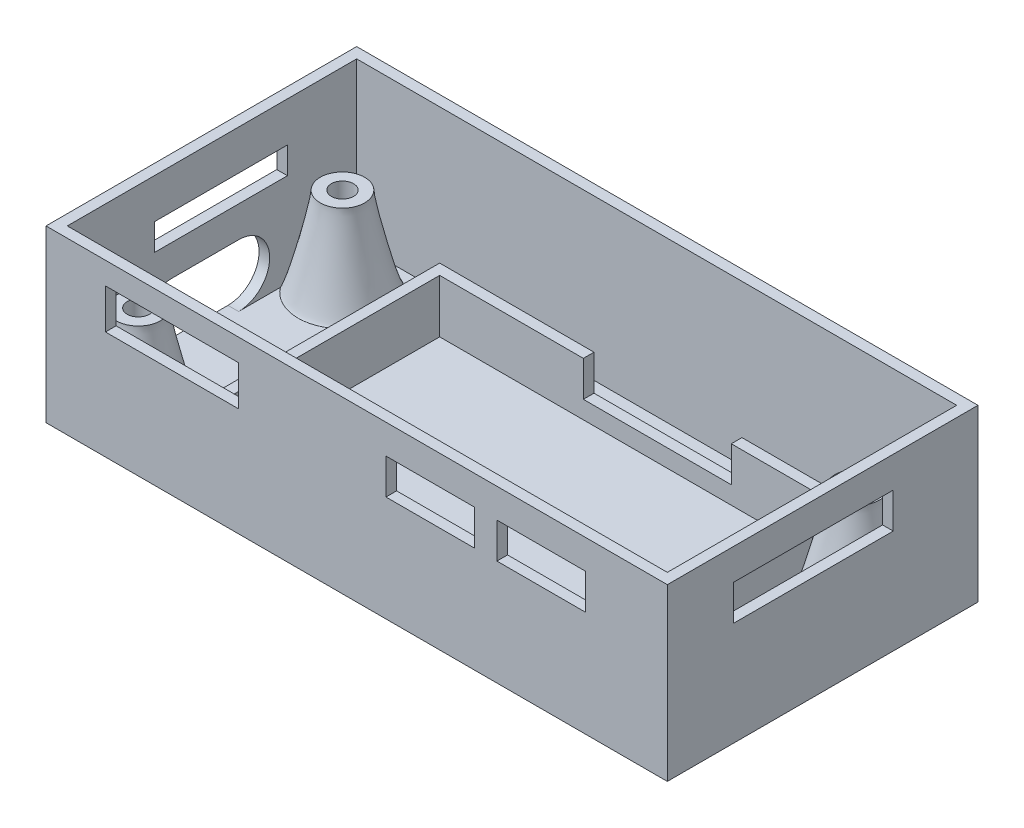
from build123d import *

# Parameters (mm, degrees)
SKETCH1_W           = 70
SKETCH1_H           = 35
BOSS_EXTRUDE1_DEPTH = 1.2
SKETCH2_W           = 70
SKETCH2_H           = 35
SKETCH2_W_2         = 67.6
SKETCH2_H_2         = 32.6
BOSS_EXTRUDE2_DEPTH = 18
SKETCH3_R           = 2.5
BOSS_EXTRUDE3_DEPTH = 10
SKETCH4_R           = 1.25
CUT_EXTRUDE1_DEPTH  = 80.05972426
SKETCH5_W           = 15
SKETCH5_H           = 3
CUT_EXTRUDE2_DEPTH  = 2
SKETCH7_W           = 10
SKETCH7_H           = 4
CUT_EXTRUDE3_DEPTH  = 2
SKETCH8_W           = 15
SKETCH8_H           = 4.5
CUT_EXTRUDE4_DEPTH  = 2
SKETCH9_W           = 18
SKETCH9_H           = 4
CUT_EXTRUDE5_DEPTH  = 2
FILLET1_SIZE        = 2.5
FILLET1_SIZE_2      = 10
SKETCH15_R          = 3.5
CUT_EXTRUDE7_DEPTH  = 2
SKETCH17_W          = 45.2
SKETCH17_H          = 26.1
SKETCH17_W_2        = 42.8
SKETCH17_H_2        = 23.7
BOSS_EXTRUDE4_DEPTH = 6
SKETCH18_W          = 7.5
SKETCH18_H          = 7
CUT_EXTRUDE8_DEPTH  = 2
SKETCH19_W          = 16.668937074
SKETCH19_H          = 28.144751767
CUT_EXTRUDE9_DEPTH  = 4


with BuildPart() as part:
    # Sketch1 → Boss-Extrude1 (new body)
    with BuildSketch(Plane(origin=(0, 0, 0), x_dir=(1, 0, 0), z_dir=(0, 1, 0))):
        with Locations((35, -17.5)):
            Rectangle(SKETCH1_W, SKETCH1_H)
    extrude(amount=BOSS_EXTRUDE1_DEPTH)

    # Sketch2 → Boss-Extrude2 (add)
    with BuildSketch(Plane(origin=(0, 1.2, 0), x_dir=(1, 0, 0), z_dir=(0, 1, 0))):
        with Locations((35, -17.5)):
            Rectangle(SKETCH2_W, SKETCH2_H)
        with Locations((35, -17.5)):
            Rectangle(SKETCH2_W_2, SKETCH2_H_2, mode=Mode.SUBTRACT)
    extrude(amount=BOSS_EXTRUDE2_DEPTH)

    # Sketch3 → Boss-Extrude3 (add)
    with BuildSketch(Plane(origin=(0, 1.2, 0), x_dir=(1, 0, 0), z_dir=(0, 1, 0))):
        with Locations(Location((5.2, -29.8, 0), (0, 0, 270))):
            Circle(SKETCH3_R)
        with Locations(Location((63.2, -29.8, 0), (0, 0, 270))):
            Circle(SKETCH3_R)
        with Locations(Location((63.2, -6.8, 0), (0, 0, 270))):
            Circle(SKETCH3_R)
        with Locations(Location((5.2, -6.8, 0), (0, 0, 270))):
            Circle(SKETCH3_R)
    extrude(amount=BOSS_EXTRUDE3_DEPTH)

    # Sketch4 → Cut-Extrude1 (cut, through all)
    with BuildSketch(Plane(origin=(0, 11.2, 0), x_dir=(1, 0, 0), z_dir=(0, 1, 0))):
        with Locations(Location((5.2, -29.8, 0), (0, 0, 270))):
            Circle(SKETCH4_R)
        with Locations(Location((5.2, -6.8, 0), (0, 0, 270))):
            Circle(SKETCH4_R)
        with Locations(Location((63.2, -6.8, 0), (0, 0, 270))):
            Circle(SKETCH4_R)
        with Locations(Location((63.2, -29.8, 0), (0, 0, 270))):
            Circle(SKETCH4_R)
    extrude(amount=-CUT_EXTRUDE1_DEPTH, mode=Mode.SUBTRACT)

    # Sketch5 → Cut-Extrude2 (cut)
    with BuildSketch(Plane.ZY):
        with Locations((16.5, 13.2)):
            Rectangle(SKETCH5_W, SKETCH5_H)
    extrude(amount=-CUT_EXTRUDE2_DEPTH, mode=Mode.SUBTRACT)

    # Sketch7 → Cut-Extrude3 (cut)
    with BuildSketch(Plane(origin=(0, 0, 33.8), x_dir=(-1, 0, 0), z_dir=(0, 0, -1))):
        with Locations((-55.8, 13.9)):
            Rectangle(SKETCH7_W, SKETCH7_H)
        with Locations((-43.3, 13.9)):
            Rectangle(SKETCH7_W, SKETCH7_H)
    extrude(amount=-CUT_EXTRUDE3_DEPTH, mode=Mode.SUBTRACT)

    # Sketch8 → Cut-Extrude4 (cut)
    with BuildSketch(Plane(origin=(0, 0, 33.8), x_dir=(-1, 0, 0), z_dir=(0, 0, -1))):
        with Locations((-14.2, 14.45)):
            Rectangle(SKETCH8_W, SKETCH8_H)
    extrude(amount=-CUT_EXTRUDE4_DEPTH, mode=Mode.SUBTRACT)

    # Sketch9 → Cut-Extrude5 (cut)
    with BuildSketch(Plane.ZY.offset(-68.8)):
        with Locations((18.55, 13.7)):
            Rectangle(SKETCH9_W, SKETCH9_H)
    extrude(amount=-CUT_EXTRUDE5_DEPTH, mode=Mode.SUBTRACT)

    # Fillet1
    # a fillet whose section is not a circle: 10, 2.5 mm, written as the material it adds along each edge
    with BuildSketch(Plane(origin=(5.2, 1.2, 29.8), x_dir=(0, 0, 1), z_dir=(-1, 0, 0))) as fillet1_piece_1:
        with BuildLine():
            Bezier((2.5 + FILLET1_SIZE, 0), (2.5, 0), (2.5, FILLET1_SIZE_2), weights=[1, 0.111111111, 1])
            Line((2.5, FILLET1_SIZE_2), (2.5, 0))
            Line((2.5, 0), (2.5 + FILLET1_SIZE, 0))
        make_face()
    revolve(axis=Axis((5.2, 1.2, 29.8), (0, 1, 0)))
    with BuildSketch(Plane(origin=(63.2, 1.2, 29.8), x_dir=(0, 0, 1), z_dir=(-1, 0, 0))) as fillet1_piece_2:
        with BuildLine():
            Bezier((2.5 + FILLET1_SIZE, 0), (2.5, 0), (2.5, FILLET1_SIZE_2), weights=[1, 0.111111111, 1])
            Line((2.5, FILLET1_SIZE_2), (2.5, 0))
            Line((2.5, 0), (2.5 + FILLET1_SIZE, 0))
        make_face()
    revolve(axis=Axis((63.2, 1.2, 29.8), (0, 1, 0)))
    with BuildSketch(Plane(origin=(63.2, 1.2, 6.8), x_dir=(0, 0, 1), z_dir=(-1, 0, 0))) as fillet1_piece_3:
        with BuildLine():
            Bezier((2.5 + FILLET1_SIZE, 0), (2.5, 0), (2.5, FILLET1_SIZE_2), weights=[1, 0.111111111, 1])
            Line((2.5, FILLET1_SIZE_2), (2.5, 0))
            Line((2.5, 0), (2.5 + FILLET1_SIZE, 0))
        make_face()
    revolve(axis=Axis((63.2, 1.2, 6.8), (0, 1, 0)))
    with BuildSketch(Plane(origin=(5.2, 1.2, 6.8), x_dir=(0, 0, 1), z_dir=(-1, 0, 0))) as fillet1_piece_4:
        with BuildLine():
            Bezier((2.5 + FILLET1_SIZE, 0), (2.5, 0), (2.5, FILLET1_SIZE_2), weights=[1, 0.111111111, 1])
            Line((2.5, FILLET1_SIZE_2), (2.5, 0))
            Line((2.5, 0), (2.5 + FILLET1_SIZE, 0))
        make_face()
    revolve(axis=Axis((5.2, 1.2, 6.8), (0, 1, 0)))

    # Sketch15 → Cut-Extrude7 (cut)
    with BuildSketch(Plane(origin=(1.2, 0, 0), x_dir=(0, 0, -1), z_dir=(1, 0, 0))):
        with Locations((-14.5, 4.7)):
            Circle(SKETCH15_R)
        with Locations((-22, 4.7)):
            Circle(SKETCH15_R)
    extrude(amount=-CUT_EXTRUDE7_DEPTH, mode=Mode.SUBTRACT)

    # Sketch17 → Boss-Extrude4 (add)
    with BuildSketch(Plane(origin=(0, 1.2, 0), x_dir=(1, 0, 0), z_dir=(0, 1, 0))):
        with Locations((36.4, -17.5)):
            Rectangle(SKETCH17_W, SKETCH17_H)
        with Locations((36.4, -17.5)):
            Rectangle(SKETCH17_W_2, SKETCH17_H_2, mode=Mode.SUBTRACT)
    extrude(amount=BOSS_EXTRUDE4_DEPTH)

    # Sketch18 → Cut-Extrude8 (cut)
    with BuildSketch(Plane.ZY):
        with Locations((18.25, 4.7)):
            Rectangle(SKETCH18_W, SKETCH18_H)
    extrude(amount=-CUT_EXTRUDE8_DEPTH, mode=Mode.SUBTRACT)

    # Sketch19 → Cut-Extrude9 (cut)
    with BuildSketch(Plane(origin=(0, 7.2, 0), x_dir=(1, 0, 0), z_dir=(0, 1, 0))):
        with Locations((39.522291187, -17.367289001)):
            Rectangle(SKETCH19_W, SKETCH19_H)
    extrude(amount=-CUT_EXTRUDE9_DEPTH, mode=Mode.SUBTRACT)


solid = part.part
